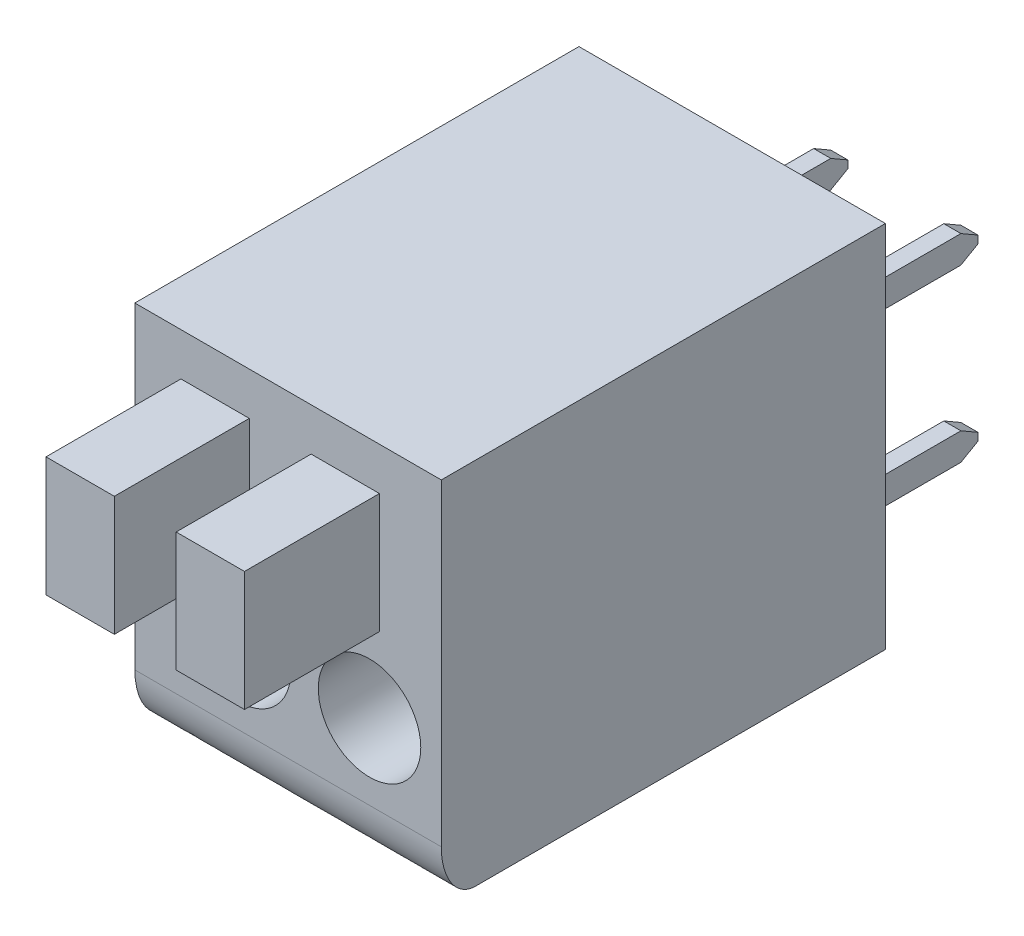
from build123d import *
from OCP.BRepFilletAPI import BRepFilletAPI_MakeChamfer

# Parameters (mm, degrees)
SKETCH_1_W                          = 8.97
SKETCH_1_H                          = 10.8
EXTRUDE_1_DEPTH                     = 13
FILLET_1_SIZE                       = 1
FILLET_1_SIZE_2                     = 1.5
SKETCH_2_W                          = 2
SKETCH_2_H                          = 3.5
EXTRUDE_2_DEPTH                     = 3.95
SKETCH_3_R                          = 1.5
CUT_EXTRUDE_1_DEPTH                 = 3.95
SKETCH_4_W                          = 0.5
SKETCH_4_H                          = 0.8
EXTRUDE_3_DEPTH                     = 3.5
CHAMFER_1_SIZE                      = 0.5
CHAMFER_1_SIZE2                     = 0.288675135
PATTERN_LINEAR_2_COUNT              = 2
PATTERN_LINEAR_2_PITCH              = 3.81
CHAMFER_1_OF_PATTERN_LINEAR_2_SIZE  = 0.5
CHAMFER_1_OF_PATTERN_LINEAR_2_SIZE2 = 0.288675135


with BuildPart() as part:
    # Эскиз1 → Бобышка-Вытянуть1 (new body)
    with BuildSketch(Plane.XY):
        Rectangle(SKETCH_1_W, SKETCH_1_H)
    extrude(amount=EXTRUDE_1_DEPTH)

    # Скругление1
    # an asymmetric fillet: 1.5, 1 mm, written as the material it takes off along each edge
    with BuildSketch(Plane(origin=(-8.235, -5.4, 13), x_dir=(0, 0, -1), z_dir=(1, 0, 0))) as fillet_1_piece_1:
        with BuildLine():
            Bezier((FILLET_1_SIZE, 0), (0, 0), (0, FILLET_1_SIZE_2), weights=[1, 0.707106781, 1])
            Line((0, FILLET_1_SIZE_2), (0, 0))
            Line((0, 0), (FILLET_1_SIZE, 0))
        make_face()
    extrude(amount=16.47, mode=Mode.SUBTRACT)

    # Эскиз2 → Бобышка-Вытянуть2 (add)
    with BuildSketch(Plane.XY.offset(13)):
        with Locations((1.675, 2.4)):
            Rectangle(SKETCH_2_W, SKETCH_2_H)
    extrude_2 = extrude(amount=EXTRUDE_2_DEPTH)

    # Эскиз3 → Вырез-Вытянуть1 (cut)
    with BuildSketch(Plane.XY.offset(13)):
        with Locations((2.385, -1.686021073)):
            Circle(SKETCH_3_R)
    cut_extrude_1 = extrude(amount=-CUT_EXTRUDE_1_DEPTH, mode=Mode.SUBTRACT)

    # Эскиз4 → Бобышка-Вытянуть3 (add)
    with BuildSketch(Plane(origin=(0, 0, 0), x_dir=(-1, 0, 0), z_dir=(0, 0, -1))):
        with Locations((-3.445, 2.85)):
            Rectangle(SKETCH_4_W, SKETCH_4_H)
        with Locations((-3.445, -2.15)):
            Rectangle(SKETCH_4_W, SKETCH_4_H)
    extrude_3 = extrude(amount=EXTRUDE_3_DEPTH)

    # Фаска1: one chamfer whose edges measure the first distance from different faces: ONE call of the kernel's chamfer builder (chamfer() names one face for all edges)
    chamfer_1_edges_1 = [part.edges().sort_by_distance(p)[0] for p in [
        (3.445, 3.25, -3.5),
    ]]
    chamfer_1_side_1 = [part.faces().sort_by_distance(p)[0] for p in [
        (3.445, 3.25, -1.75),
    ]]
    chamfer_1_edges_2 = [part.edges().sort_by_distance(p)[0] for p in [
        (3.445, 2.45, -3.5),
    ]]
    chamfer_1_side_2 = [part.faces().sort_by_distance(p)[0] for p in [
        (3.445, 2.45, -1.75),
    ]]
    chamfer_1_edges_3 = [part.edges().sort_by_distance(p)[0] for p in [
        (3.445, -2.55, -3.5),
    ]]
    chamfer_1_side_3 = [part.faces().sort_by_distance(p)[0] for p in [
        (3.445, -2.55, -1.75),
    ]]
    chamfer_1_edges_4 = [part.edges().sort_by_distance(p)[0] for p in [
        (3.445, -1.75, -3.5),
    ]]
    chamfer_1_side_4 = [part.faces().sort_by_distance(p)[0] for p in [
        (3.445, -1.75, -1.75),
    ]]
    chamfer_1 = BRepFilletAPI_MakeChamfer(part.part.solid().wrapped)
    for e in chamfer_1_edges_1:
        chamfer_1.Add(CHAMFER_1_SIZE, CHAMFER_1_SIZE2, e.wrapped, chamfer_1_side_1[0].wrapped)  # the first distance lies on this face
    for e in chamfer_1_edges_2:
        chamfer_1.Add(CHAMFER_1_SIZE, CHAMFER_1_SIZE2, e.wrapped, chamfer_1_side_2[0].wrapped)  # the first distance lies on this face
    for e in chamfer_1_edges_3:
        chamfer_1.Add(CHAMFER_1_SIZE, CHAMFER_1_SIZE2, e.wrapped, chamfer_1_side_3[0].wrapped)  # the first distance lies on this face
    for e in chamfer_1_edges_4:
        chamfer_1.Add(CHAMFER_1_SIZE, CHAMFER_1_SIZE2, e.wrapped, chamfer_1_side_4[0].wrapped)  # the first distance lies on this face
    add(Compound.cast(chamfer_1.Shape()), mode=Mode.REPLACE)

    # Линейный массив2: Бобышка-Вытянуть2, Вырез-Вытянуть1, Бобышка-Вытянуть3 ×2
    with Locations(*[(-i * PATTERN_LINEAR_2_PITCH, 0, 0) for i in range(1, PATTERN_LINEAR_2_COUNT)]):
        add(extrude_2)
        add(cut_extrude_1, mode=Mode.SUBTRACT)
        add(extrude_3)

    # Фаска1 of Линейный массив2: one chamfer whose edges measure the first distance from different faces: ONE call of the kernel's chamfer builder (chamfer() names one face for all edges)
    chamfer_1_of_pattern_linear_2_edges_1 = [part.edges().sort_by_distance(p)[0] for p in [
        (-0.365, 3.25, -3.5),
    ]]
    chamfer_1_of_pattern_linear_2_side_1 = [part.faces().sort_by_distance(p)[0] for p in [
        (-0.365, 3.25, -1.75),
    ]]
    chamfer_1_of_pattern_linear_2_edges_2 = [part.edges().sort_by_distance(p)[0] for p in [
        (-0.365, 2.45, -3.5),
    ]]
    chamfer_1_of_pattern_linear_2_side_2 = [part.faces().sort_by_distance(p)[0] for p in [
        (-0.365, 2.45, -1.75),
    ]]
    chamfer_1_of_pattern_linear_2_edges_3 = [part.edges().sort_by_distance(p)[0] for p in [
        (-0.365, -2.55, -3.5),
    ]]
    chamfer_1_of_pattern_linear_2_side_3 = [part.faces().sort_by_distance(p)[0] for p in [
        (-0.365, -2.55, -1.75),
    ]]
    chamfer_1_of_pattern_linear_2_edges_4 = [part.edges().sort_by_distance(p)[0] for p in [
        (-0.365, -1.75, -3.5),
    ]]
    chamfer_1_of_pattern_linear_2_side_4 = [part.faces().sort_by_distance(p)[0] for p in [
        (-0.365, -1.75, -1.75),
    ]]
    chamfer_1_of_pattern_linear_2 = BRepFilletAPI_MakeChamfer(part.part.solid().wrapped)
    for e in chamfer_1_of_pattern_linear_2_edges_1:
        chamfer_1_of_pattern_linear_2.Add(CHAMFER_1_OF_PATTERN_LINEAR_2_SIZE, CHAMFER_1_OF_PATTERN_LINEAR_2_SIZE2, e.wrapped, chamfer_1_of_pattern_linear_2_side_1[0].wrapped)  # the first distance lies on this face
    for e in chamfer_1_of_pattern_linear_2_edges_2:
        chamfer_1_of_pattern_linear_2.Add(CHAMFER_1_OF_PATTERN_LINEAR_2_SIZE, CHAMFER_1_OF_PATTERN_LINEAR_2_SIZE2, e.wrapped, chamfer_1_of_pattern_linear_2_side_2[0].wrapped)  # the first distance lies on this face
    for e in chamfer_1_of_pattern_linear_2_edges_3:
        chamfer_1_of_pattern_linear_2.Add(CHAMFER_1_OF_PATTERN_LINEAR_2_SIZE, CHAMFER_1_OF_PATTERN_LINEAR_2_SIZE2, e.wrapped, chamfer_1_of_pattern_linear_2_side_3[0].wrapped)  # the first distance lies on this face
    for e in chamfer_1_of_pattern_linear_2_edges_4:
        chamfer_1_of_pattern_linear_2.Add(CHAMFER_1_OF_PATTERN_LINEAR_2_SIZE, CHAMFER_1_OF_PATTERN_LINEAR_2_SIZE2, e.wrapped, chamfer_1_of_pattern_linear_2_side_4[0].wrapped)  # the first distance lies on this face
    add(Compound.cast(chamfer_1_of_pattern_linear_2.Shape()), mode=Mode.REPLACE)


solid = part.part
